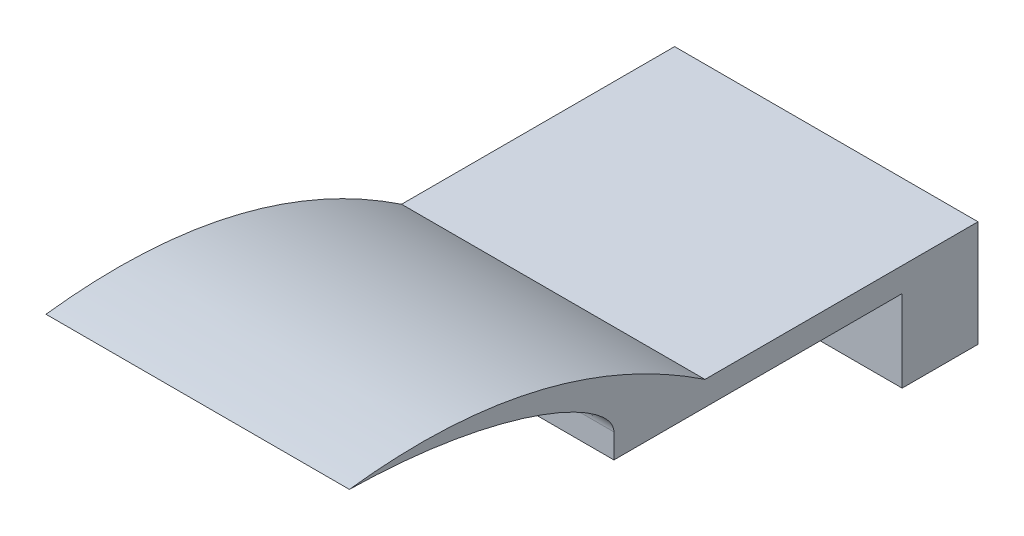
from build123d import *

# Parameters (mm, degrees)
BOSS_EXTRUDE1_DEPTH     = 63.5
CUT_EXTRUDE1_DEPTH      = 168.419011538
CUT_EXTRUDE1_DEPTH_BACK = 168.419011538
SKETCH2_R               = 3.175
BOSS_EXTRUDE2_START     = 114.3
SKETCH3_W               = 127
SKETCH3_H               = 44.45
SKETCH3_R               = 3.175
BOSS_EXTRUDE2_DEPTH     = 114.3
SKETCH4_W               = 101.6
SKETCH4_H               = 34.29
CUT_EXTRUDE2_DEPTH      = 211.546717743


with BuildPart() as part:
    # Sketch1 → Boss-Extrude1 (new, symmetric)
    with BuildSketch(Plane(origin=(0, 0, 0), x_dir=(0, 0, -1), z_dir=(1, 0, 0))):
        with BuildLine():
            Line((9.953260665, 1.527522938), (9.953260665, -8.632477062))
            Line((9.953260665, -8.632477062), (29.003260665, -8.632477062))
            Line((29.003260665, -8.632477062), (29.003260665, -42.922477062))
            Line((29.003260665, -42.922477062), (48.053260665, -42.922477062))
            Line((48.053260665, -42.922477062), (48.053260665, 1.527522938))
            add(Edge.make_bspline(
                [(-100.790739335, 36.068), (-19.032711445, 46.301406021), (48.053260665, 1.527522938)],
                knots=[0, 0, 0, 1, 1, 1], degree=2))
            add(Edge.make_bspline(
                [(-100.790739335, 36.068), (-95.472009051, 35.970053962), (-84.335207916, 35.497495721), (-67.84267644, 33.915291048), (-51.836102186, 31.40452262), (-37.369384582, 28.207814634), (-24.621041831, 24.500526142), (-13.737485443, 20.457861588), (-4.831226741, 16.256541913), (2.04810392, 12.063126076), (6.858444868, 7.976115249), (9.417519863, 4.43561678), (9.910164477, 2.202629327), (9.953260665, 1.527522938)],
                knots=[0.35379081, 0.35379081, 0.35379081, 0.35379081, 0.374279703, 0.396711254, 0.417576734, 0.436654006, 0.45374439, 0.468679994, 0.481329415, 0.491630702, 0.499615789, 0.505546281, 0.508115399, 0.508115399, 0.508115399, 0.508115399], degree=3))
        make_face()
    extrude(amount=BOSS_EXTRUDE1_DEPTH, both=True)

    # Sketch2 → Cut-Extrude1 (cut, two sides: drawn at the far end of the back side and taken through both)
    with BuildSketch(Plane(origin=(0, 0, -48.053260665), x_dir=(-1, 0, 0), z_dir=(0, 0, -1)).offset(-CUT_EXTRUDE1_DEPTH_BACK)):
        with Locations((-31.75, -19.300477062)):
            Circle(SKETCH2_R)
        with Locations((31.75, -19.300477062)):
            Circle(SKETCH2_R)
    extrude(amount=CUT_EXTRUDE1_DEPTH + CUT_EXTRUDE1_DEPTH_BACK, mode=Mode.SUBTRACT)

    # Sketch3 → Boss-Extrude2 (add)
    with BuildSketch(Plane(origin=(0, 0, -48.053260665), x_dir=(-1, 0, 0), z_dir=(0, 0, -1)).offset(BOSS_EXTRUDE2_START)):
        with Locations((0, -20.697477062)):
            Rectangle(SKETCH3_W, SKETCH3_H)
        with Locations((-31.75, -19.300477062)):
            Circle(SKETCH3_R, mode=Mode.SUBTRACT)
        with Locations((31.75, -19.300477062)):
            Circle(SKETCH3_R, mode=Mode.SUBTRACT)
    extrude(amount=-BOSS_EXTRUDE2_DEPTH)

    # Sketch4 → Cut-Extrude2 (cut, through all)
    with BuildSketch(Plane.ZY.offset(63.5)):
        with Locations((-79.803260665, -25.777477062)):
            Rectangle(SKETCH4_W, SKETCH4_H)
    extrude(amount=-CUT_EXTRUDE2_DEPTH, mode=Mode.SUBTRACT)


solid = part.part
